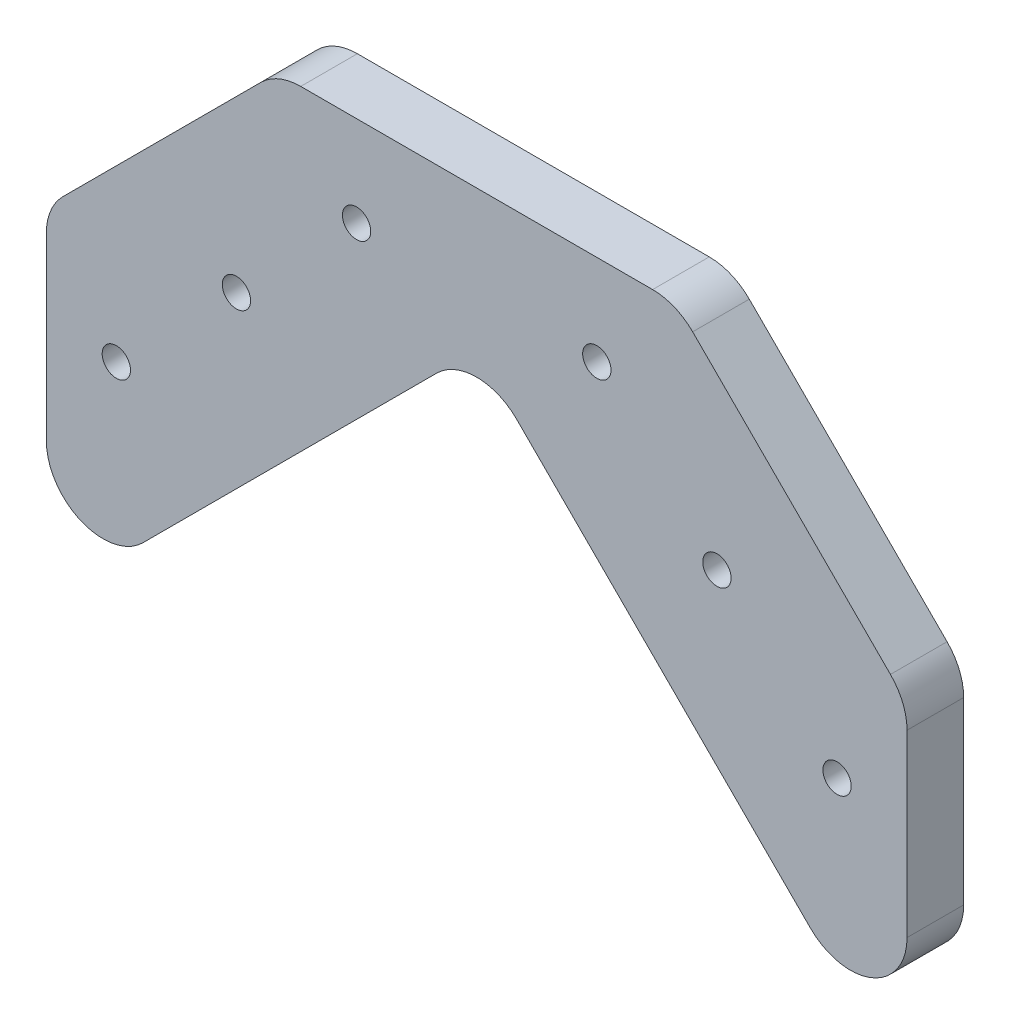
from build123d import *

# Parameters (mm, degrees)
SKETCH1_R           = 1.25
BOSS_EXTRUDE1_DEPTH = 5
FILLET1_R           = 5


with BuildPart() as part:
    # Sketch1 → Boss-Extrude1 (new body)
    with BuildSketch(Plane.XY):
        Polygon((-38, 74.828427125), (0, 112.828427125), (38, 74.828427125), (38, 104.828427125), (17.606601718, 125.221825407), (0, 125.221825407), (-17.606601718, 125.221825407), (-38, 104.828427125), align=None)
        with Locations((-31.819805153, 96.008621971)):
            Circle(SKETCH1_R, mode=Mode.SUBTRACT)
        with Locations((-21.213203436, 106.615223689)):
            Circle(SKETCH1_R, mode=Mode.SUBTRACT)
        with Locations((-10.606601718, 117.221825407)):
            Circle(SKETCH1_R, mode=Mode.SUBTRACT)
        with Locations((10.606601718, 117.221825407)):
            Circle(SKETCH1_R, mode=Mode.SUBTRACT)
        with Locations((21.213203436, 106.615223689)):
            Circle(SKETCH1_R, mode=Mode.SUBTRACT)
        with Locations((31.819805153, 96.008621971)):
            Circle(SKETCH1_R, mode=Mode.SUBTRACT)
    extrude(amount=BOSS_EXTRUDE1_DEPTH)

    # Fillet1
    fillet1_edges = [part.edges().sort_by_distance(p)[0] for p in [
        (0, 112.828427125, 2.5),
        (-38, 74.828427125, 2.5),
        (38, 74.828427125, 2.5),
        (38, 104.828427125, 2.5),
        (-38, 104.828427125, 2.5),
        (17.606601718, 125.221825407, 2.5),
        (-17.606601718, 125.221825407, 2.5),
    ]]
    fillet(fillet1_edges, radius=FILLET1_R)


solid = part.part
